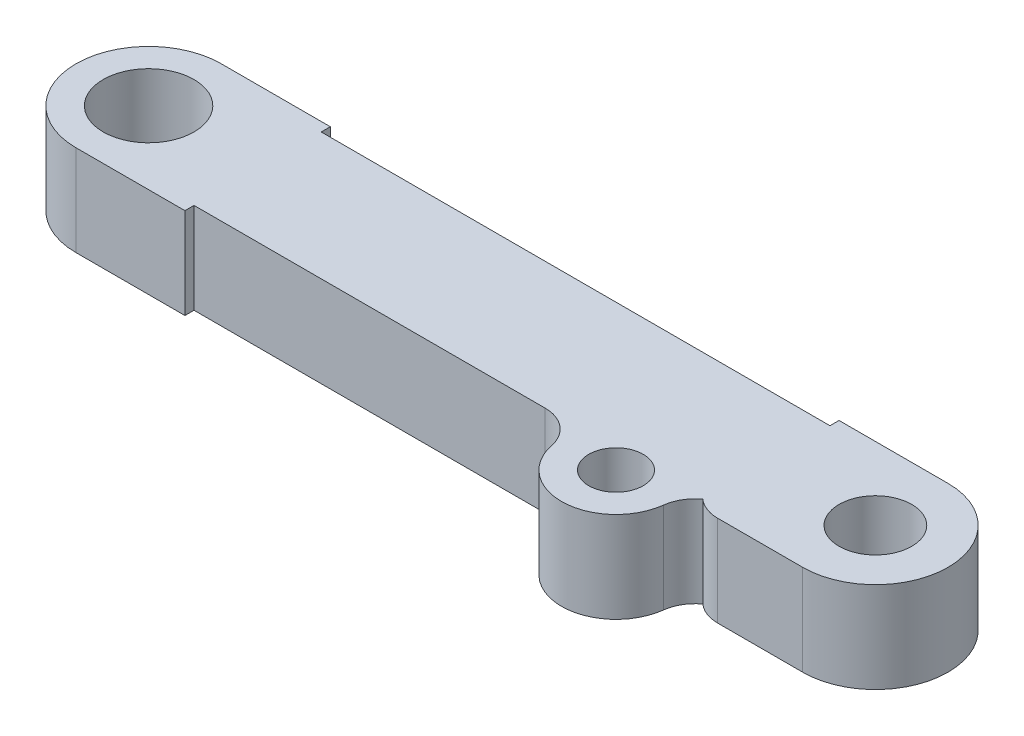
from build123d import *

# Parameters (mm, degrees)
SKETCH1_R           = 30
SKETCH1_R_2         = 50
SKETCH1_R_3         = 40
BOSS_EXTRUDE1_DEPTH = 100
FILLET1_R           = 40
FILLET2_R           = 40
FILLET3_R           = 40


with BuildPart() as part:
    # Sketch1 → Boss-Extrude1 (new body)
    with BuildSketch(Plane(origin=(0, 0, 0), x_dir=(1, 0, 0), z_dir=(0, 1, 0))):
        with BuildLine():
            Line((0, 80), (120, 80))
            Line((120, 80), (120, 70))
            Line((120, 70), (680, 70))
            Line((680, 70), (680, 80))
            Line((680, 80), (800, 80))
            ThreePointArc((800, 80), (880, 0), (800, -80))
            Line((800, -80), (680, -80))
            Line((680, -80), (680, -70))
            Line((680, -70), (661.048491655, -70))
            ThreePointArc((661.048491655, -70), (604.479949161, -150), (547.911406666, -70))
            Line((547.911406666, -70), (120, -70))
            Line((120, -70), (120, -80))
            Line((120, -80), (0, -80))
            ThreePointArc((0, -80), (-80, 0), (0, 80))
        make_face()
        with Locations(Location((604.479949161, -90, 0), (0, 0, 270))):
            Circle(SKETCH1_R, mode=Mode.SUBTRACT)
        with Locations(Location((0, 0, 0), (0, 0, 270))):
            Circle(SKETCH1_R_2, mode=Mode.SUBTRACT)
        with Locations(Location((800, 0, 0), (0, 0, 270))):
            Circle(SKETCH1_R_3, mode=Mode.SUBTRACT)
    extrude(amount=BOSS_EXTRUDE1_DEPTH)

    # Fillet1
    fillet1_edges = [part.edges().sort_by_distance(p)[0] for p in [
        (547.911406666, 50, 70),
    ]]
    fillet(fillet1_edges, radius=FILLET1_R)

    # Fillet2
    # the kernel refuses this fillet: 40 mm, written as the material it adds along each edge
    with BuildSketch(Plane(origin=(661.048491655, 0, 70), x_dir=(0.10855976910838376, 0, 0.9940899237650156), z_dir=(0, 1, 0))) as fillet2_piece_1:
        with BuildLine():
            CenterArc((36.641948169, 38.936942319), FILLET2_R, 210.161293822, 46.599784771)
            Line((2.05737137, 18.839503485), (1.365679834, 18.437554709))
            ThreePointArc((1.365679834, 18.437554709), (0.233413746, 9.506599558), (-0.795271939, 0.086847815))
            Line((-0.795271939, 0.086847815), (0.183209741, -0.778738846))
            ThreePointArc((0.183209741, -0.778738846), (13.740730563, 0.794586522), (27.298251386, -0.778738846))
            Line((27.298251386, -0.778738846), (27.481461127, 0))
        make_face()
    extrude(amount=100)

    # Fillet3
    # the kernel refuses this fillet: 40 mm, written as the material it takes off along each edge
    with BuildSketch(Plane(origin=(680, -66.143782777, 80), x_dir=(0, 0, -1), z_dir=(0, 1, 0))) as fillet3_piece_1:
        with BuildLine():
            CenterArc((40, -26.457513111), FILLET3_R, 138.590377891, 41.409622109)
            Line((0, -26.457513111), (-0.8, -26.457513111))
            Line((-0.8, -26.457513111), (-0.8, 0))
            Line((-0.8, 0), (0, 0.8))
            ThreePointArc((0, 0.8), (5, 0.8), (9.4, 0.529150262))
            Line((9.4, 0.529150262), (10, 0))
        make_face()
    extrude(amount=232.287565553, mode=Mode.SUBTRACT)


solid = part.part
